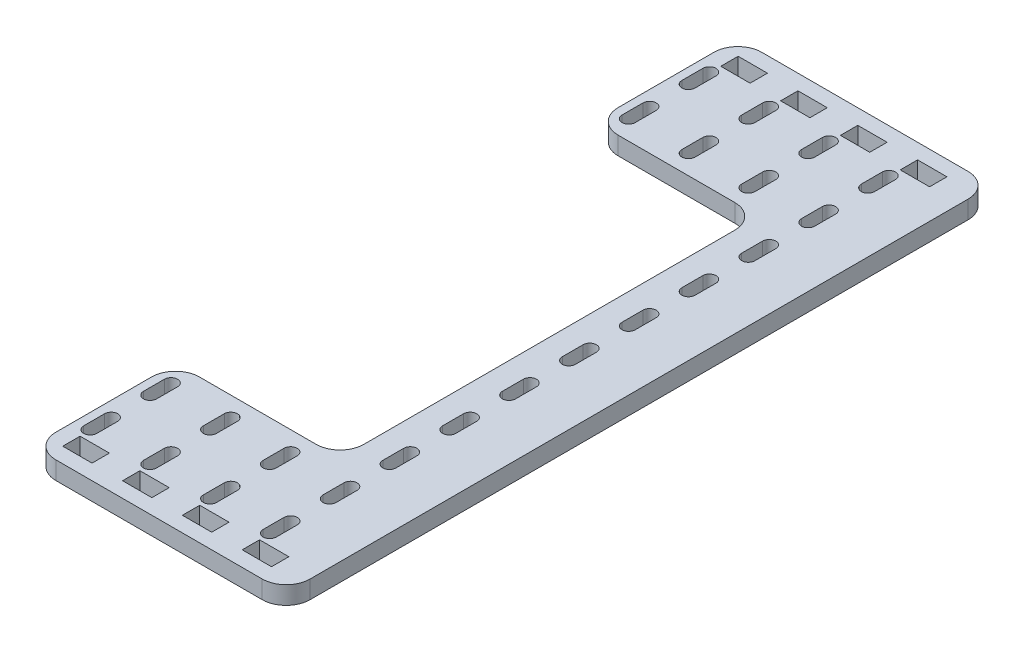
from build123d import *

# Parameters (mm, degrees)
SKETCH1_W           = 85
SKETCH1_H           = 236
BOSS_EXTRUDE1_DEPTH = 6
SKETCH2_W           = 9.8
SKETCH2_H           = 5.8
CUT_EXTRUDE1_DEPTH  = 6
CUT_EXTRUDE2_DEPTH  = 127.360868241
SKETCH5_W           = 55
SKETCH5_H           = 140
CUT_EXTRUDE3_DEPTH  = 127.360868241
FILLET1_R           = 8


with BuildPart() as part:
    # Sketch1 → Boss-Extrude1 (new body)
    with BuildSketch(Plane(origin=(0, 0, 0), x_dir=(1, 0, 0), z_dir=(0, 1, 0))):
        with Locations((-0.623184748, -0.623184748)):
            Rectangle(SKETCH1_W, SKETCH1_H)
    extrude(amount=BOSS_EXTRUDE1_DEPTH)

    # Sketch2 → Cut-Extrude1 (cut)
    with BuildSketch(Plane(origin=(0, 6, 0), x_dir=(1, 0, 0), z_dir=(0, 1, 0))):
        with Locations((6.976815252, -110.623184748)):
            Rectangle(SKETCH2_W, SKETCH2_H)
        with Locations((26.976815252, -110.623184748)):
            Rectangle(SKETCH2_W, SKETCH2_H)
        with Locations((-13.023184748, -110.623184748)):
            Rectangle(SKETCH2_W, SKETCH2_H)
        with Locations((-33.023184748, -110.623184748)):
            Rectangle(SKETCH2_W, SKETCH2_H)
    cut_extrude1 = extrude(amount=-CUT_EXTRUDE1_DEPTH, mode=Mode.SUBTRACT)

    # Mirror2: Cut-Extrude1 across plane
    add(cut_extrude1.mirror(Plane.XY.offset(0.623184748)), mode=Mode.SUBTRACT)

    # Sketch4 → Cut-Extrude2 (cut, through all)
    with BuildSketch(Plane(origin=(0, 6, 0), x_dir=(1, 0, 0), z_dir=(0, 1, 0))):
        with BuildLine():
            ThreePointArc((19.676815252, 95.876815252), (21.876815252, 93.676815252), (24.076815252, 95.876815252))
            Line((24.076815252, 95.876815252), (24.076815252, 102.876815252))
            ThreePointArc((24.076815252, 102.876815252), (21.876815252, 105.076815252), (19.676815252, 102.876815252))
            Line((19.676815252, 102.876815252), (19.676815252, 95.876815252))
        make_face()
        with BuildLine():
            ThreePointArc((-0.323184748, 95.876815252), (1.876815252, 93.676815252), (4.076815252, 95.876815252))
            Line((4.076815252, 95.876815252), (4.076815252, 102.876815252))
            ThreePointArc((4.076815252, 102.876815252), (1.876815252, 105.076815252), (-0.323184748, 102.876815252))
            Line((-0.323184748, 102.876815252), (-0.323184748, 95.876815252))
        make_face()
        with BuildLine():
            ThreePointArc((-20.323184748, 95.876815252), (-18.123184748, 93.676815252), (-15.923184748, 95.876815252))
            Line((-15.923184748, 95.876815252), (-15.923184748, 102.876815252))
            ThreePointArc((-15.923184748, 102.876815252), (-18.123184748, 105.076815252), (-20.323184748, 102.876815252))
            Line((-20.323184748, 102.876815252), (-20.323184748, 95.876815252))
        make_face()
        with BuildLine():
            ThreePointArc((-40.323184748, 95.876815252), (-38.123184748, 93.676815252), (-35.923184748, 95.876815252))
            Line((-35.923184748, 95.876815252), (-35.923184748, 102.876815252))
            ThreePointArc((-35.923184748, 102.876815252), (-38.123184748, 105.076815252), (-40.323184748, 102.876815252))
            Line((-40.323184748, 102.876815252), (-40.323184748, 95.876815252))
        make_face()
        with BuildLine():
            ThreePointArc((-0.323184748, 75.876815252), (1.876815252, 73.676815252), (4.076815252, 75.876815252))
            Line((4.076815252, 75.876815252), (4.076815252, 82.876815252))
            ThreePointArc((4.076815252, 82.876815252), (1.876815252, 85.076815252), (-0.323184748, 82.876815252))
            Line((-0.323184748, 82.876815252), (-0.323184748, 75.876815252))
        make_face()
        with BuildLine():
            ThreePointArc((-20.323184748, 75.876815252), (-18.123184748, 73.676815252), (-15.923184748, 75.876815252))
            Line((-15.923184748, 75.876815252), (-15.923184748, 82.876815252))
            ThreePointArc((-15.923184748, 82.876815252), (-18.123184748, 85.076815252), (-20.323184748, 82.876815252))
            Line((-20.323184748, 82.876815252), (-20.323184748, 75.876815252))
        make_face()
        with BuildLine():
            ThreePointArc((-40.323184748, 75.876815252), (-38.123184748, 73.676815252), (-35.923184748, 75.876815252))
            Line((-35.923184748, 75.876815252), (-35.923184748, 82.876815252))
            ThreePointArc((-35.923184748, 82.876815252), (-38.123184748, 85.076815252), (-40.323184748, 82.876815252))
            Line((-40.323184748, 82.876815252), (-40.323184748, 75.876815252))
        make_face()
        with BuildLine():
            ThreePointArc((-0.323184748, 55.876815252), (1.876815252, 53.676815252), (4.076815252, 55.876815252))
            Line((4.076815252, 55.876815252), (4.076815252, 62.876815252))
            ThreePointArc((4.076815252, 62.876815252), (1.876815252, 65.076815252), (-0.323184748, 62.876815252))
            Line((-0.323184748, 62.876815252), (-0.323184748, 55.876815252))
        make_face()
        with BuildLine():
            ThreePointArc((-20.323184748, 55.876815252), (-18.123184748, 53.676815252), (-15.923184748, 55.876815252))
            Line((-15.923184748, 55.876815252), (-15.923184748, 62.876815252))
            ThreePointArc((-15.923184748, 62.876815252), (-18.123184748, 65.076815252), (-20.323184748, 62.876815252))
            Line((-20.323184748, 62.876815252), (-20.323184748, 55.876815252))
        make_face()
        with BuildLine():
            ThreePointArc((-40.323184748, 55.876815252), (-38.123184748, 53.676815252), (-35.923184748, 55.876815252))
            Line((-35.923184748, 55.876815252), (-35.923184748, 62.876815252))
            ThreePointArc((-35.923184748, 62.876815252), (-38.123184748, 65.076815252), (-40.323184748, 62.876815252))
            Line((-40.323184748, 62.876815252), (-40.323184748, 55.876815252))
        make_face()
        with BuildLine():
            ThreePointArc((-0.323184748, 35.876815252), (1.876815252, 33.676815252), (4.076815252, 35.876815252))
            Line((4.076815252, 35.876815252), (4.076815252, 42.876815252))
            ThreePointArc((4.076815252, 42.876815252), (1.876815252, 45.076815252), (-0.323184748, 42.876815252))
            Line((-0.323184748, 42.876815252), (-0.323184748, 35.876815252))
        make_face()
        with BuildLine():
            ThreePointArc((-20.323184748, 35.876815252), (-18.123184748, 33.676815252), (-15.923184748, 35.876815252))
            Line((-15.923184748, 35.876815252), (-15.923184748, 42.876815252))
            ThreePointArc((-15.923184748, 42.876815252), (-18.123184748, 45.076815252), (-20.323184748, 42.876815252))
            Line((-20.323184748, 42.876815252), (-20.323184748, 35.876815252))
        make_face()
        with BuildLine():
            ThreePointArc((-40.323184748, 35.876815252), (-38.123184748, 33.676815252), (-35.923184748, 35.876815252))
            Line((-35.923184748, 35.876815252), (-35.923184748, 42.876815252))
            ThreePointArc((-35.923184748, 42.876815252), (-38.123184748, 45.076815252), (-40.323184748, 42.876815252))
            Line((-40.323184748, 42.876815252), (-40.323184748, 35.876815252))
        make_face()
        with BuildLine():
            ThreePointArc((-0.323184748, 15.876815252), (1.876815252, 13.676815252), (4.076815252, 15.876815252))
            Line((4.076815252, 15.876815252), (4.076815252, 22.876815252))
            ThreePointArc((4.076815252, 22.876815252), (1.876815252, 25.076815252), (-0.323184748, 22.876815252))
            Line((-0.323184748, 22.876815252), (-0.323184748, 15.876815252))
        make_face()
        with BuildLine():
            ThreePointArc((-20.323184748, 15.876815252), (-18.123184748, 13.676815252), (-15.923184748, 15.876815252))
            Line((-15.923184748, 15.876815252), (-15.923184748, 22.876815252))
            ThreePointArc((-15.923184748, 22.876815252), (-18.123184748, 25.076815252), (-20.323184748, 22.876815252))
            Line((-20.323184748, 22.876815252), (-20.323184748, 15.876815252))
        make_face()
        with BuildLine():
            ThreePointArc((-40.323184748, 15.876815252), (-38.123184748, 13.676815252), (-35.923184748, 15.876815252))
            Line((-35.923184748, 15.876815252), (-35.923184748, 22.876815252))
            ThreePointArc((-35.923184748, 22.876815252), (-38.123184748, 25.076815252), (-40.323184748, 22.876815252))
            Line((-40.323184748, 22.876815252), (-40.323184748, 15.876815252))
        make_face()
        with BuildLine():
            ThreePointArc((-0.323184748, -4.123184748), (1.876815252, -6.323184748), (4.076815252, -4.123184748))
            Line((4.076815252, -4.123184748), (4.076815252, 2.876815252))
            ThreePointArc((4.076815252, 2.876815252), (1.876815252, 5.076815252), (-0.323184748, 2.876815252))
            Line((-0.323184748, 2.876815252), (-0.323184748, -4.123184748))
        make_face()
        with BuildLine():
            ThreePointArc((-20.323184748, -4.123184748), (-18.123184748, -6.323184748), (-15.923184748, -4.123184748))
            Line((-15.923184748, -4.123184748), (-15.923184748, 2.876815252))
            ThreePointArc((-15.923184748, 2.876815252), (-18.123184748, 5.076815252), (-20.323184748, 2.876815252))
            Line((-20.323184748, 2.876815252), (-20.323184748, -4.123184748))
        make_face()
        with BuildLine():
            ThreePointArc((-40.323184748, -4.123184748), (-38.123184748, -6.323184748), (-35.923184748, -4.123184748))
            Line((-35.923184748, -4.123184748), (-35.923184748, 2.876815252))
            ThreePointArc((-35.923184748, 2.876815252), (-38.123184748, 5.076815252), (-40.323184748, 2.876815252))
            Line((-40.323184748, 2.876815252), (-40.323184748, -4.123184748))
        make_face()
        with BuildLine():
            ThreePointArc((-0.323184748, -24.123184748), (1.876815252, -26.323184748), (4.076815252, -24.123184748))
            Line((4.076815252, -24.123184748), (4.076815252, -17.123184748))
            ThreePointArc((4.076815252, -17.123184748), (1.876815252, -14.923184748), (-0.323184748, -17.123184748))
            Line((-0.323184748, -17.123184748), (-0.323184748, -24.123184748))
        make_face()
        with BuildLine():
            ThreePointArc((-20.323184748, -24.123184748), (-18.123184748, -26.323184748), (-15.923184748, -24.123184748))
            Line((-15.923184748, -24.123184748), (-15.923184748, -17.123184748))
            ThreePointArc((-15.923184748, -17.123184748), (-18.123184748, -14.923184748), (-20.323184748, -17.123184748))
            Line((-20.323184748, -17.123184748), (-20.323184748, -24.123184748))
        make_face()
        with BuildLine():
            ThreePointArc((-40.323184748, -24.123184748), (-38.123184748, -26.323184748), (-35.923184748, -24.123184748))
            Line((-35.923184748, -24.123184748), (-35.923184748, -17.123184748))
            ThreePointArc((-35.923184748, -17.123184748), (-38.123184748, -14.923184748), (-40.323184748, -17.123184748))
            Line((-40.323184748, -17.123184748), (-40.323184748, -24.123184748))
        make_face()
        with BuildLine():
            ThreePointArc((-0.323184748, -44.123184748), (1.876815252, -46.323184748), (4.076815252, -44.123184748))
            Line((4.076815252, -44.123184748), (4.076815252, -37.123184748))
            ThreePointArc((4.076815252, -37.123184748), (1.876815252, -34.923184748), (-0.323184748, -37.123184748))
            Line((-0.323184748, -37.123184748), (-0.323184748, -44.123184748))
        make_face()
        with BuildLine():
            ThreePointArc((-20.323184748, -44.123184748), (-18.123184748, -46.323184748), (-15.923184748, -44.123184748))
            Line((-15.923184748, -44.123184748), (-15.923184748, -37.123184748))
            ThreePointArc((-15.923184748, -37.123184748), (-18.123184748, -34.923184748), (-20.323184748, -37.123184748))
            Line((-20.323184748, -37.123184748), (-20.323184748, -44.123184748))
        make_face()
        with BuildLine():
            ThreePointArc((-40.323184748, -44.123184748), (-38.123184748, -46.323184748), (-35.923184748, -44.123184748))
            Line((-35.923184748, -44.123184748), (-35.923184748, -37.123184748))
            ThreePointArc((-35.923184748, -37.123184748), (-38.123184748, -34.923184748), (-40.323184748, -37.123184748))
            Line((-40.323184748, -37.123184748), (-40.323184748, -44.123184748))
        make_face()
        with BuildLine():
            ThreePointArc((-0.323184748, -64.123184748), (1.876815252, -66.323184748), (4.076815252, -64.123184748))
            Line((4.076815252, -64.123184748), (4.076815252, -57.123184748))
            ThreePointArc((4.076815252, -57.123184748), (1.876815252, -54.923184748), (-0.323184748, -57.123184748))
            Line((-0.323184748, -57.123184748), (-0.323184748, -64.123184748))
        make_face()
        with BuildLine():
            ThreePointArc((-20.323184748, -64.123184748), (-18.123184748, -66.323184748), (-15.923184748, -64.123184748))
            Line((-15.923184748, -64.123184748), (-15.923184748, -57.123184748))
            ThreePointArc((-15.923184748, -57.123184748), (-18.123184748, -54.923184748), (-20.323184748, -57.123184748))
            Line((-20.323184748, -57.123184748), (-20.323184748, -64.123184748))
        make_face()
        with BuildLine():
            ThreePointArc((-40.323184748, -64.123184748), (-38.123184748, -66.323184748), (-35.923184748, -64.123184748))
            Line((-35.923184748, -64.123184748), (-35.923184748, -57.123184748))
            ThreePointArc((-35.923184748, -57.123184748), (-38.123184748, -54.923184748), (-40.323184748, -57.123184748))
            Line((-40.323184748, -57.123184748), (-40.323184748, -64.123184748))
        make_face()
        with BuildLine():
            ThreePointArc((-0.323184748, -84.123184748), (1.876815252, -86.323184748), (4.076815252, -84.123184748))
            Line((4.076815252, -84.123184748), (4.076815252, -77.123184748))
            ThreePointArc((4.076815252, -77.123184748), (1.876815252, -74.923184748), (-0.323184748, -77.123184748))
            Line((-0.323184748, -77.123184748), (-0.323184748, -84.123184748))
        make_face()
        with BuildLine():
            ThreePointArc((-20.323184748, -84.123184748), (-18.123184748, -86.323184748), (-15.923184748, -84.123184748))
            Line((-15.923184748, -84.123184748), (-15.923184748, -77.123184748))
            ThreePointArc((-15.923184748, -77.123184748), (-18.123184748, -74.923184748), (-20.323184748, -77.123184748))
            Line((-20.323184748, -77.123184748), (-20.323184748, -84.123184748))
        make_face()
        with BuildLine():
            ThreePointArc((-40.323184748, -84.123184748), (-38.123184748, -86.323184748), (-35.923184748, -84.123184748))
            Line((-35.923184748, -84.123184748), (-35.923184748, -77.123184748))
            ThreePointArc((-35.923184748, -77.123184748), (-38.123184748, -74.923184748), (-40.323184748, -77.123184748))
            Line((-40.323184748, -77.123184748), (-40.323184748, -84.123184748))
        make_face()
        with BuildLine():
            ThreePointArc((-0.323184748, -104.123184748), (1.876815252, -106.323184748), (4.076815252, -104.123184748))
            Line((4.076815252, -104.123184748), (4.076815252, -97.123184748))
            ThreePointArc((4.076815252, -97.123184748), (1.876815252, -94.923184748), (-0.323184748, -97.123184748))
            Line((-0.323184748, -97.123184748), (-0.323184748, -104.123184748))
        make_face()
        with BuildLine():
            ThreePointArc((-20.323184748, -104.123184748), (-18.123184748, -106.323184748), (-15.923184748, -104.123184748))
            Line((-15.923184748, -104.123184748), (-15.923184748, -97.123184748))
            ThreePointArc((-15.923184748, -97.123184748), (-18.123184748, -94.923184748), (-20.323184748, -97.123184748))
            Line((-20.323184748, -97.123184748), (-20.323184748, -104.123184748))
        make_face()
        with BuildLine():
            ThreePointArc((-40.323184748, -104.123184748), (-38.123184748, -106.323184748), (-35.923184748, -104.123184748))
            Line((-35.923184748, -104.123184748), (-35.923184748, -97.123184748))
            ThreePointArc((-35.923184748, -97.123184748), (-38.123184748, -94.923184748), (-40.323184748, -97.123184748))
            Line((-40.323184748, -97.123184748), (-40.323184748, -104.123184748))
        make_face()
        with BuildLine():
            ThreePointArc((19.676815252, 75.876815252), (21.876815252, 73.676815252), (24.076815252, 75.876815252))
            Line((24.076815252, 75.876815252), (24.076815252, 82.876815252))
            ThreePointArc((24.076815252, 82.876815252), (21.876815252, 85.076815252), (19.676815252, 82.876815252))
            Line((19.676815252, 82.876815252), (19.676815252, 75.876815252))
        make_face()
        with BuildLine():
            ThreePointArc((19.676815252, 55.876815252), (21.876815252, 53.676815252), (24.076815252, 55.876815252))
            Line((24.076815252, 55.876815252), (24.076815252, 62.876815252))
            ThreePointArc((24.076815252, 62.876815252), (21.876815252, 65.076815252), (19.676815252, 62.876815252))
            Line((19.676815252, 62.876815252), (19.676815252, 55.876815252))
        make_face()
        with BuildLine():
            ThreePointArc((19.676815252, 35.876815252), (21.876815252, 33.676815252), (24.076815252, 35.876815252))
            Line((24.076815252, 35.876815252), (24.076815252, 42.876815252))
            ThreePointArc((24.076815252, 42.876815252), (21.876815252, 45.076815252), (19.676815252, 42.876815252))
            Line((19.676815252, 42.876815252), (19.676815252, 35.876815252))
        make_face()
        with BuildLine():
            ThreePointArc((19.676815252, 15.876815252), (21.876815252, 13.676815252), (24.076815252, 15.876815252))
            Line((24.076815252, 15.876815252), (24.076815252, 22.876815252))
            ThreePointArc((24.076815252, 22.876815252), (21.876815252, 25.076815252), (19.676815252, 22.876815252))
            Line((19.676815252, 22.876815252), (19.676815252, 15.876815252))
        make_face()
        with BuildLine():
            ThreePointArc((19.676815252, -4.123184748), (21.876815252, -6.323184748), (24.076815252, -4.123184748))
            Line((24.076815252, -4.123184748), (24.076815252, 2.876815252))
            ThreePointArc((24.076815252, 2.876815252), (21.876815252, 5.076815252), (19.676815252, 2.876815252))
            Line((19.676815252, 2.876815252), (19.676815252, -4.123184748))
        make_face()
        with BuildLine():
            ThreePointArc((19.676815252, -24.123184748), (21.876815252, -26.323184748), (24.076815252, -24.123184748))
            Line((24.076815252, -24.123184748), (24.076815252, -17.123184748))
            ThreePointArc((24.076815252, -17.123184748), (21.876815252, -14.923184748), (19.676815252, -17.123184748))
            Line((19.676815252, -17.123184748), (19.676815252, -24.123184748))
        make_face()
        with BuildLine():
            ThreePointArc((19.676815252, -44.123184748), (21.876815252, -46.323184748), (24.076815252, -44.123184748))
            Line((24.076815252, -44.123184748), (24.076815252, -37.123184748))
            ThreePointArc((24.076815252, -37.123184748), (21.876815252, -34.923184748), (19.676815252, -37.123184748))
            Line((19.676815252, -37.123184748), (19.676815252, -44.123184748))
        make_face()
        with BuildLine():
            ThreePointArc((19.676815252, -64.123184748), (21.876815252, -66.323184748), (24.076815252, -64.123184748))
            Line((24.076815252, -64.123184748), (24.076815252, -57.123184748))
            ThreePointArc((24.076815252, -57.123184748), (21.876815252, -54.923184748), (19.676815252, -57.123184748))
            Line((19.676815252, -57.123184748), (19.676815252, -64.123184748))
        make_face()
        with BuildLine():
            ThreePointArc((19.676815252, -84.123184748), (21.876815252, -86.323184748), (24.076815252, -84.123184748))
            Line((24.076815252, -84.123184748), (24.076815252, -77.123184748))
            ThreePointArc((24.076815252, -77.123184748), (21.876815252, -74.923184748), (19.676815252, -77.123184748))
            Line((19.676815252, -77.123184748), (19.676815252, -84.123184748))
        make_face()
        with BuildLine():
            ThreePointArc((19.676815252, -104.123184748), (21.876815252, -106.323184748), (24.076815252, -104.123184748))
            Line((24.076815252, -104.123184748), (24.076815252, -97.123184748))
            ThreePointArc((24.076815252, -97.123184748), (21.876815252, -94.923184748), (19.676815252, -97.123184748))
            Line((19.676815252, -97.123184748), (19.676815252, -104.123184748))
        make_face()
    extrude(amount=-CUT_EXTRUDE2_DEPTH, mode=Mode.SUBTRACT)

    # Sketch5 → Cut-Extrude3 (cut, through all)
    with BuildSketch(Plane(origin=(0, 6, 0), x_dir=(1, 0, 0), z_dir=(0, 1, 0))):
        with Locations((-15.623184748, -0.623184748)):
            Rectangle(SKETCH5_W, SKETCH5_H)
    extrude(amount=-CUT_EXTRUDE3_DEPTH, mode=Mode.SUBTRACT)

    # Fillet1
    fillet1_edges = [part.edges().sort_by_distance(p)[0] for p in [
        (41.876815252, 3, -117.376815252),
        (11.876815252, 3, -69.376815252),
        (11.876815252, 3, 70.623184748),
        (41.876815252, 3, 118.623184748),
        (-43.123184748, 3, 118.623184748),
        (-43.123184748, 3, 70.623184748),
        (-43.123184748, 3, -117.376815252),
        (-43.123184748, 3, -69.376815252),
    ]]
    fillet(fillet1_edges, radius=FILLET1_R)


solid = part.part
